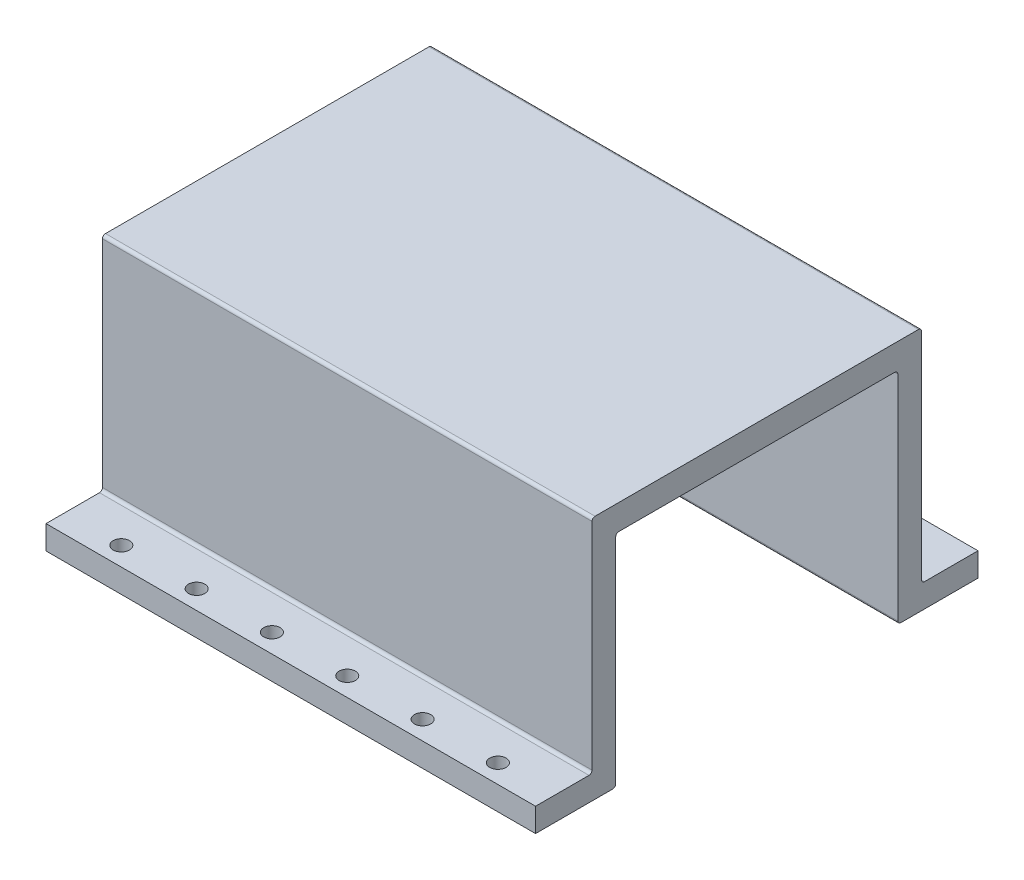
from build123d import *

# Parameters (mm, degrees)
BOSS_EXTRUDE1_DEPTH      = 50.8
BOSS_EXTRUDE1_DEPTH_BACK = 114.3
FILLET1_R                = 1.016
SKETCH4_R                = 2.75
CUT_EXTRUDE1_DEPTH       = 101.6


with BuildPart() as part:
    # Sketch2 → Boss-Extrude1 (new, two sides: drawn at the far end of the back side and taken through both)
    with BuildSketch(Plane(origin=(0, 0, 0), x_dir=(0, 0, -1), z_dir=(1, 0, 0)).offset(-BOSS_EXTRUDE1_DEPTH_BACK)):
        Polygon((-74.6125, 0), (-55.5625, 0), (-55.5625, 74.676), (55.5625, 74.676), (55.5625, 0), (74.6125, 0), (74.6125, -8), (47.5625, -8), (47.5625, 66.176), (-47.5625, 66.176), (-47.5625, -8), (-74.6125, -8), align=None)
    extrude(amount=BOSS_EXTRUDE1_DEPTH + BOSS_EXTRUDE1_DEPTH_BACK)

    # Fillet1
    fillet1_edges = [part.edges().sort_by_distance(p)[0] for p in [
        (-31.75, 66.176, -47.5625),
        (-31.75, 74.676, -55.5625),
        (-31.75, 74.676, 55.5625),
        (-31.75, 66.176, 47.5625),
        (-31.75, 0, -55.5625),
        (-31.75, -8, -47.5625),
        (-31.75, -8, 47.5625),
        (-31.75, 0, 55.5625),
    ]]
    fillet(fillet1_edges, radius=FILLET1_R)

    # Sketch4 → Cut-Extrude1 (cut)
    with BuildSketch(Plane(origin=(0, 0, 0), x_dir=(1, 0, 0), z_dir=(0, 1, 0))):
        with Locations((-95.25, 68.2625)):
            Circle(SKETCH4_R)
        with Locations((-69.85, 68.2625)):
            Circle(SKETCH4_R)
        with Locations((-44.45, 68.2625)):
            Circle(SKETCH4_R)
        with Locations((-19.05, 68.2625)):
            Circle(SKETCH4_R)
        with Locations((6.35, 68.2625)):
            Circle(SKETCH4_R)
        with Locations((31.75, 68.2625)):
            Circle(SKETCH4_R)
    cut_extrude1 = extrude(amount=-CUT_EXTRUDE1_DEPTH, mode=Mode.SUBTRACT)

    # Mirror1: Cut-Extrude1 across plane
    add(cut_extrude1.mirror(Plane.XY), mode=Mode.SUBTRACT)


solid = part.part
